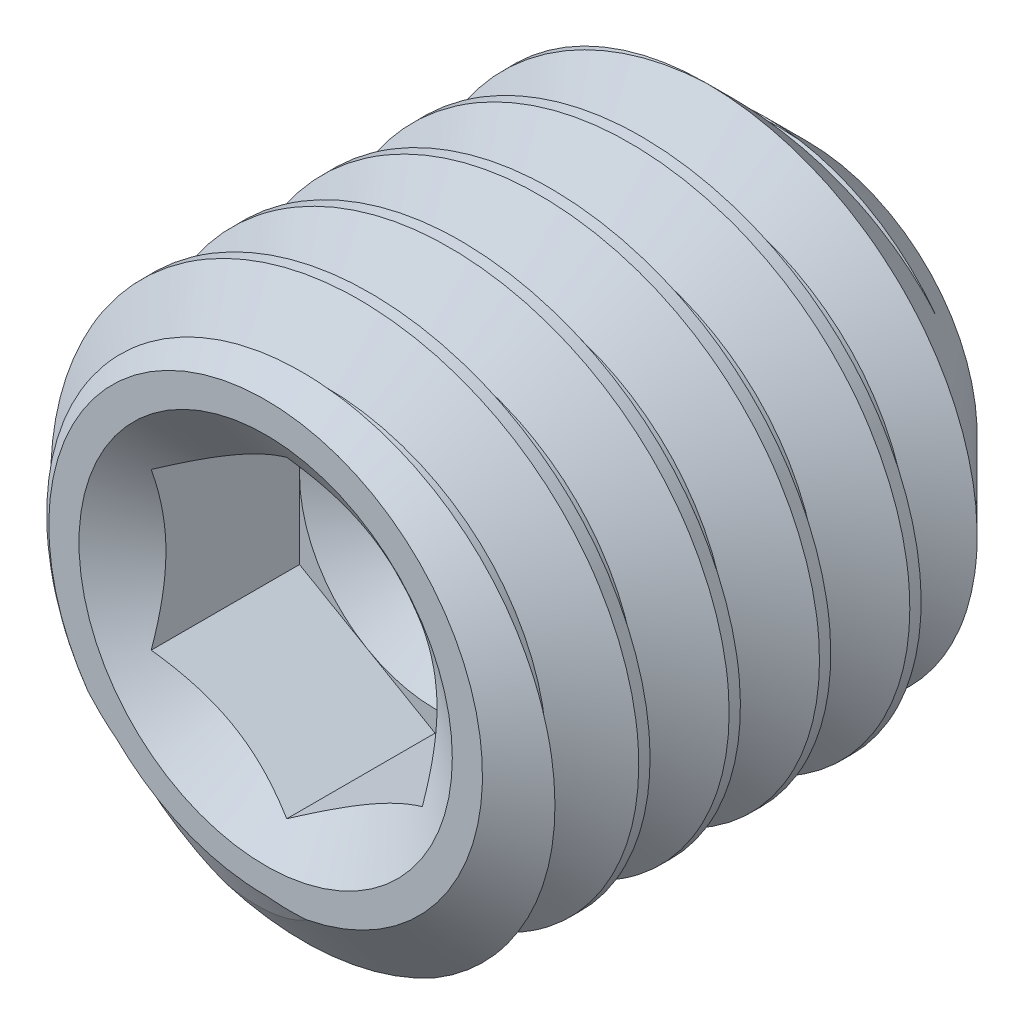
from build123d import *

# Parameters (mm, degrees)
CUT_EXTRUDE3_DEPTH = 0.9375
CUT_SWEEP1_PITCH   = 0.5


with BuildPart() as part:
    # Sketch4 → Revolve1 (revolve)
    with BuildSketch(Plane(origin=(0, 0, 0), x_dir=(0, 0, -1), z_dir=(1, 0, 0))):
        with BuildLine():
            Line((1.280834109, 0), (1.612041367, 0.551221444))
            ThreePointArc((1.612041367, 0.551221444), (1.691888731, 0.737071218), (1.719165891, 0.9375))
            Line((1.719165891, 0.9375), (1.156665891, 1.5))
            Line((1.156665891, 1.5), (-1.070771847, 1.5))
            Line((-1.070771847, 1.5), (-1.280834109, 1.2))
            Line((-1.280834109, 1.2), (-1.280834109, 0))
            Line((-1.280834109, 0), (1.280834109, 0))
        make_face()
    revolve(axis=Axis((0, 0, -1.280834109), (0, 0, 1)))

    # Sketch6 → Cut-Extrude3 (cut)
    with BuildSketch(Plane.XY.offset(1.280834109)):
        Polygon((0.75, 0.433012702), (0, 0.866025404), (-0.75, 0.433012702), (-0.75, -0.433012702), (0, -0.866025404), (0.75, -0.433012702), align=None)
    extrude(amount=-CUT_EXTRUDE3_DEPTH, mode=Mode.SUBTRACT)

    # Cut-Extrude4 cone 1 section (through the dimple's axis) → Cut-Extrude4 (revolve, cut)
    with BuildSketch(Plane(origin=(0, 0, 1.280834109), x_dir=(0, -1, 0), z_dir=(1, 0, 0))):
        Polygon((0, 0), (1.033012702, 0), (0, 0.723323281), align=None)
    revolve(axis=Axis((0, 0, 1.280834109), (0, 0, -1)), mode=Mode.SUBTRACT)

    # Cut-Extrude5 cone 1 section (through the dimple's axis) → Cut-Extrude5 (revolve, cut)
    with BuildSketch(Plane(origin=(0, 0, 0.343334109), x_dir=(0, -1, 0), z_dir=(1, 0, 0))):
        Polygon((0, 0), (0.75, 0), (0, 0.433012702), align=None)
    revolve(axis=Axis((0, 0, 0.343334109), (0, 0, -1)), mode=Mode.SUBTRACT)

    # Cut-Sweep1: the profile of Sketch10 profile screwed along a right-hand helix of 7 turns, 6 arcs to a turn; built about Z, then put on its axis
    cut_sweep1_z = Axis((0, 0, 0), (0, 0, 1))
    cut_sweep1_corners = [(1.5003, 0, 0.000173205), (1.5003, 0, -0.437673205), (1.175240474, 0, -0.25), (1.175240474, 0, -0.1875)]
    with BuildLine(mode=Mode.PRIVATE) as cut_sweep1_profile:
        Line(cut_sweep1_corners[0], cut_sweep1_corners[1])
        Line(cut_sweep1_corners[1], cut_sweep1_corners[2])
        Line(cut_sweep1_corners[2], cut_sweep1_corners[3])
        Line(cut_sweep1_corners[3], cut_sweep1_corners[0])
    cut_sweep1_cap = Face(cut_sweep1_profile.wire())
    cut_sweep1_turn_angles = [0, 30, 60, 90, 120, 150, 180, 210, 240, 270, 300, 330, 360]
    cut_sweep1_turn_weights = [1, 0.8660254037844387, 1, 0.8660254037844387, 1, 0.8660254037844387, 1, 0.8660254037844387, 1, 0.8660254037844387, 1, 0.8660254037844387, 1]
    cut_sweep1_turn_rails = [Edge.make_bspline([Vector(p[0], p[1], 0).rotate(cut_sweep1_z, cut_sweep1_turn_angles[k]) / cut_sweep1_turn_weights[k] + Vector(0, 0, p[2] + CUT_SWEEP1_PITCH * cut_sweep1_turn_angles[k] / 360) for k in range(13)], [0, 0, 0, 1, 1, 2, 2, 3, 3, 4, 4, 5, 5, 6, 6, 6], 2, cut_sweep1_turn_weights) for p in cut_sweep1_corners]
    cut_sweep1_turn_sides = [Face.make_surface_from_curves(cut_sweep1_turn_rails[p[0]], cut_sweep1_turn_rails[p[1]]) for p in [(0, 1), (1, 2), (2, 3), (3, 0)]]
    cut_sweep1 = Plane(origin=(0, 0, -1.719165891), x_dir=(0, 1, 0), z_dir=(0, 0, 1)) * Solid(Shell([*[p.moved(Location((0, 0, CUT_SWEEP1_PITCH * i))) for i in range(7) for p in cut_sweep1_turn_sides], cut_sweep1_cap, cut_sweep1_cap.rotate(cut_sweep1_z, 2520).moved(Location((0, 0, CUT_SWEEP1_PITCH * 2520 / 360)))]))
    add(cut_sweep1, mode=Mode.SUBTRACT)


solid = part.part
